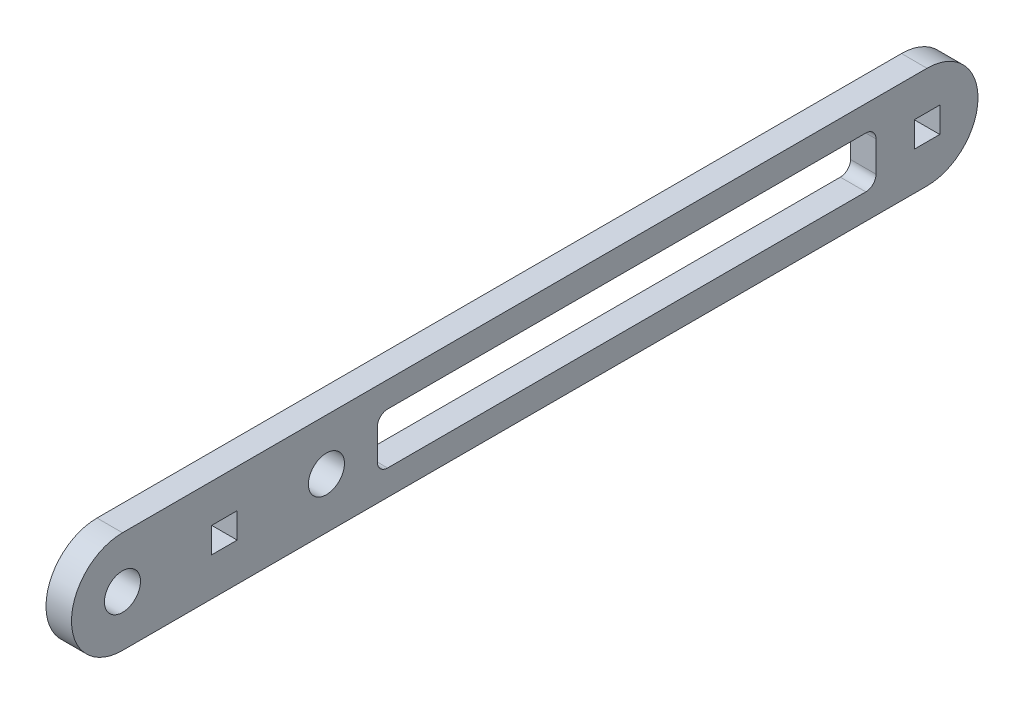
from build123d import *

# Parameters (mm, degrees)
SKETCH1_R           = 2.24506403
SKETCH1_W           = 3.175
SKETCH1_H           = 3.175
BOSS_EXTRUDE1_DEPTH = 3.175


with BuildPart() as part:
    # Sketch1 → Boss-Extrude1 (new body)
    with BuildSketch(Plane(origin=(0, 0, 0), x_dir=(0, 0, -1), z_dir=(1, 0, 0))):
        with BuildLine():
            Line((-100.203, 6.35), (0, 6.35))
            ThreePointArc((0, 6.35), (6.35, 0), (0, -6.35))
            Line((0, -6.35), (-100.203, -6.35))
            ThreePointArc((-100.203, -6.35), (-106.553, 0), (-100.203, 6.35))
        make_face()
        with Locations((-74.803, 0)):
            Circle(SKETCH1_R, mode=Mode.SUBTRACT)
        with Locations((-100.203, 0)):
            Circle(SKETCH1_R, mode=Mode.SUBTRACT)
        with Locations((-87.503, 0)):
            Rectangle(SKETCH1_W, SKETCH1_H, mode=Mode.SUBTRACT)
        with BuildLine():
            Line((-68.453, 0), (-68.453, 1.905))
            ThreePointArc((-68.453, 1.905), (-68.081025612, 2.803025612), (-67.183, 3.175))
            Line((-67.183, 3.175), (-7.62, 3.175))
            ThreePointArc((-7.62, 3.175), (-6.721974388, 2.803025612), (-6.35, 1.905))
            Line((-6.35, 1.905), (-6.35, -1.905))
            ThreePointArc((-6.35, -1.905), (-6.721974388, -2.803025612), (-7.62, -3.175))
            Line((-7.62, -3.175), (-67.183, -3.175))
            ThreePointArc((-67.183, -3.175), (-68.081025612, -2.803025612), (-68.453, -1.905))
            Line((-68.453, -1.905), (-68.453, 0))
        make_face(mode=Mode.SUBTRACT)
        Rectangle(SKETCH1_W, SKETCH1_H, mode=Mode.SUBTRACT)
    extrude(amount=BOSS_EXTRUDE1_DEPTH)


solid = part.part
